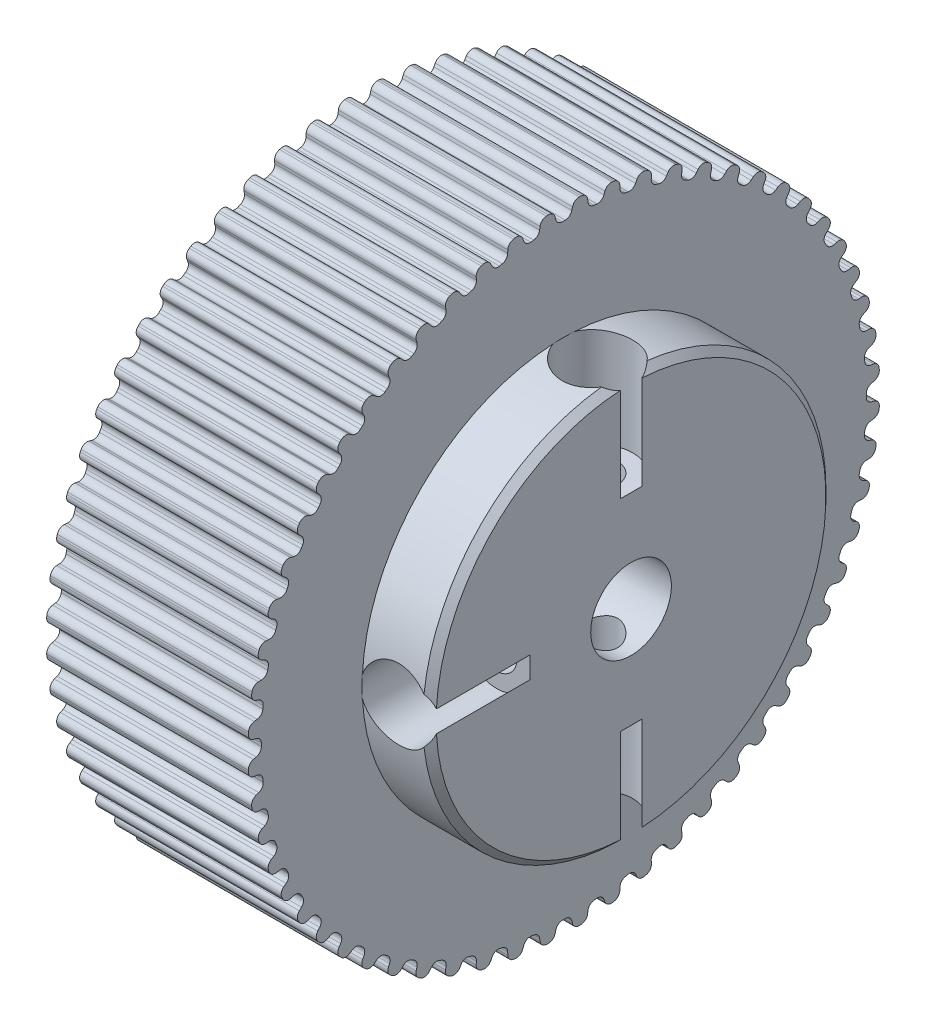
from build123d import *

# Parameters (mm, degrees)
CHAMFER1_SIZE      = 1
SKETCH2_R          = 6
CUT_EXTRUDE1_DEPTH = 78.575769413
SKETCH3_R          = 3
CUT_EXTRUDE3_DEPTH = 78.575769413
SKETCH4_R          = 5.25
CUT_EXTRUDE4_DEPTH = 15
CIRPATTERN1_COUNT  = 3
CIRPATTERN1_ANGLE  = 180
CUT_EXTRUDE5_DEPTH = 78.575769464
FILLET1_R          = 1
CIRPATTERN2_DEPTH  = 30


# Read off the part's stored shape, not the designer's step: CirPattern2
with BuildPart() as part:
    # Sketch1 → Revolve1 (revolve)
    with BuildSketch(Plane.XY, mode=Mode.PRIVATE) as revolve1_sk:
        Polygon((0, 0), (0, 47), (30, 47), (30, 30), (40, 30), (40, 0), align=None)
    revolve(revolve1_sk.sketch.rotate(Axis((-15.822381893, 0, 0), (1, 0, 0)), 90), axis=Axis((-15.822381893, 0, 0), (1, 0, 0)))

    # Chamfer1
    chamfer1_edges = [part.edges().sort_by_distance(p)[0] for p in [
        (40, 0, -30),
    ]]
    chamfer(chamfer1_edges, length=CHAMFER1_SIZE)

    # Sketch2 → Cut-Extrude1 (cut, through all)
    with BuildSketch(Plane.ZY):
        Circle(SKETCH2_R)
    extrude(amount=-CUT_EXTRUDE1_DEPTH, mode=Mode.SUBTRACT)

    # Sketch3 → Cut-Extrude3 (cut, through all)
    with BuildSketch(Plane(origin=(0, 0, 0), x_dir=(1, 0, 0), z_dir=(0, 1, 0))):
        with Locations(Location((35, 0, 0), (0, 0, 90))):
            Circle(SKETCH3_R)
    cut_extrude3 = extrude(amount=CUT_EXTRUDE3_DEPTH, mode=Mode.SUBTRACT)

    # Sketch4 → Cut-Extrude4 (cut)
    with BuildSketch(Plane(origin=(0, 30, 0), x_dir=(1, 0, 0), z_dir=(0, 1, 0))):
        with Locations((35, 0)):
            Circle(SKETCH4_R)
    cut_extrude4 = extrude(amount=-CUT_EXTRUDE4_DEPTH, mode=Mode.SUBTRACT)

    # CirPattern1: Cut-Extrude3, Cut-Extrude4 ×3 about axis
    cirpattern1_axis = Axis((0, 0, 0), (1, 0, 0))
    add([cut_extrude3.rotate(cirpattern1_axis, i * CIRPATTERN1_ANGLE / (CIRPATTERN1_COUNT - 1)) for i in range(1, CIRPATTERN1_COUNT)], mode=Mode.SUBTRACT)
    add([cut_extrude4.rotate(cirpattern1_axis, i * CIRPATTERN1_ANGLE / (CIRPATTERN1_COUNT - 1)) for i in range(1, CIRPATTERN1_COUNT)], mode=Mode.SUBTRACT)

    # Sketch6 → Cut-Extrude5 (cut, through all)
    with BuildSketch(Plane.ZY):
        Polygon((-2, 49), (2, 49), (1, 45), (-1, 45), align=None)
    extrude(amount=-CUT_EXTRUDE5_DEPTH, mode=Mode.SUBTRACT)

    # Fillet1
    fillet1_edges = [part.edges().sort_by_distance(p)[0] for p in [
        (15, 46.976246971, -1.494061743),
        (15, 45, -1),
        (15, 46.976246971, 1.494061743),
        (15, 45, 1),
    ]]
    fillet(fillet1_edges, radius=FILLET1_R)

    # CirPattern2 outline → CirPattern2 (cut)
    with BuildSketch(Plane.YZ):
        with BuildLine():
            ThreePointArc((44.776400397, 4.485758183), (45.051362819, 3.895855826), (45.631122807, 3.600106812))
            Line((45.631122807, 3.600106812), (46.069172282, 3.538260379))
            ThreePointArc((46.069172282, 3.538260379), (46.665829094, 3.224565669), (46.927837423, 2.6034736))
            ThreePointArc((46.927837423, 2.6034736), (46.742529082, 4.912837773), (46.443644181, 7.210264569))
            ThreePointArc((46.443644181, 7.210264569), (46.316493665, 6.548270257), (45.798096033, 6.117378603))
            Line((45.798096033, 6.117378603), (45.382477587, 5.965808056))
            ThreePointArc((45.382477587, 5.965808056), (44.876876423, 5.555982988), (44.730570186, 4.921803511))
            Line((44.730570186, 4.921803511), (44.776400397, 4.485758183))
        make_face()
        with BuildLine():
            ThreePointArc((45.798096033, -6.117378603), (46.316493665, -6.548270257), (46.443644181, -7.210264569))
            ThreePointArc((46.443644181, -7.210264569), (46.742529082, -4.912837773), (46.927837423, -2.6034736))
            ThreePointArc((46.927837423, -2.6034736), (46.665829094, -3.224565669), (46.069172282, -3.538260379))
            Line((46.069172282, -3.538260379), (45.631122807, -3.600106812))
            ThreePointArc((45.631122807, -3.600106812), (45.051362819, -3.895855826), (44.776400397, -4.485758183))
            Line((44.776400397, -4.485758183), (44.730570186, -4.921803511))
            ThreePointArc((44.730570186, -4.921803511), (44.876876423, -5.555982988), (45.382477587, -5.965808056))
            Line((45.382477587, -5.965808056), (45.798096033, -6.117378603))
        make_face()
        with BuildLine():
            ThreePointArc((44.907769087, -10.871071562), (45.378286439, -11.353790055), (45.435543164, -12.02544874))
            ThreePointArc((45.435543164, -12.02544874), (45.972937234, -9.771849468), (46.398624725, -7.49450623))
            ThreePointArc((46.398624725, -7.49450623), (46.073129905, -8.084808563), (45.446951616, -8.334417201))
            Line((45.446951616, -8.334417201), (45.00483711, -8.350136195))
            ThreePointArc((45.00483711, -8.350136195), (44.397338917, -8.583663644), (44.062221181, -9.141593055))
            Line((44.062221181, -9.141593055), (43.971062885, -9.570459119))
            ThreePointArc((43.971062885, -9.570459119), (44.050277835, -10.21645766), (44.510270878, -10.676887377))
            Line((44.510270878, -10.676887377), (44.907769087, -10.871071562))
        make_face()
        with BuildLine():
            ThreePointArc((43.525423224, -15.505658786), (43.942905211, -16.034915352), (43.929640827, -16.708879579))
            ThreePointArc((43.929640827, -16.708879579), (44.699656266, -14.523798736), (45.361058985, -12.303427481))
            ThreePointArc((45.361058985, -12.303427481), (44.975643864, -12.856472603), (44.326804637, -13.039260404))
            Line((44.326804637, -13.039260404), (43.885468998, -13.008679738))
            ThreePointArc((43.885468998, -13.008679738), (43.256888479, -13.177427047), (42.865287049, -13.69727072))
            Line((42.865287049, -13.69727072), (42.729799417, -14.114258774))
            ThreePointArc((42.729799417, -14.114258774), (42.741055184, -14.764998685), (43.150400327, -15.270988485))
            Line((43.150400327, -15.270988485), (43.525423224, -15.505658786))
        make_face()
        with BuildLine():
            ThreePointArc((41.666203717, -19.970362767), (42.026076318, -20.540358761), (41.942436153, -21.209244436))
            ThreePointArc((41.942436153, -21.209244436), (42.936636509, -19.116622225), (43.82650799, -16.977549806))
            ThreePointArc((43.82650799, -16.977549806), (43.385395256, -17.487278438), (42.721003911, -17.601242742))
            Line((42.721003911, -17.601242742), (42.285282505, -17.524697463))
            ThreePointArc((42.285282505, -17.524697463), (41.642506519, -17.626815801), (41.198711862, -18.10287822))
            Line((41.198711862, -18.10287822), (41.020379325, -18.503419657))
            ThreePointArc((41.020379325, -18.503419657), (40.963552589, -19.151771295), (41.317764961, -19.697777448))
            Line((41.317764961, -19.697777448), (41.666203717, -19.970362767))
        make_face()
        with BuildLine():
            ThreePointArc((39.350480563, -24.216267275), (39.648800939, -24.820757701), (39.495701372, -25.477236372))
            ThreePointArc((39.495701372, -25.477236372), (40.703193978, -23.5), (41.811784602, -21.465662542))
            ThreePointArc((41.811784602, -21.465662542), (41.31980718, -21.926489992), (40.647142927, -21.970382181))
            Line((40.647142927, -21.970382181), (40.221809608, -21.848710936))
            ThreePointArc((40.221809608, -21.848710936), (39.571880543, -21.883081473), (39.080754967, -22.310146799))
            Line((39.080754967, -22.310146799), (38.861531374, -22.689853201))
            ThreePointArc((38.861531374, -22.689853201), (38.73724474, -23.328713089), (39.032443515, -23.908753439))
            Line((39.032443515, -23.908753439), (39.350480563, -24.216267275))
        make_face()
        with BuildLine():
            ThreePointArc((36.603625308, -28.196853291), (36.837124999, -28.829215226), (36.616243421, -29.466094376))
            ThreePointArc((36.616243421, -29.466094376), (38.023798735, -27.625906858), (39.338962553, -25.718592988))
            ThreePointArc((39.338962553, -25.718592988), (38.801510649, -26.125470332), (38.127943338, -26.098809515))
            Line((38.127943338, -26.098809515), (37.717658148, -25.93334536))
            ThreePointArc((37.717658148, -25.93334536), (37.067696763, -25.899591524), (36.534621142, -26.27298074))
            Line((36.534621142, -26.27298074), (36.276908352, -26.627691966))
            ThreePointArc((36.276908352, -26.627691966), (36.086523531, -27.250060622), (36.319474449, -27.857780124))
            Line((36.319474449, -27.857780124), (36.603625308, -28.196853291))
        make_face()
        with BuildLine():
            ThreePointArc((33.455733075, -31.868508682), (33.621853809, -32.521813836), (33.335610244, -33.132115683))
            ThreePointArc((33.335610244, -33.132115683), (34.927806797, -31.449138499), (36.435134598, -29.689745146))
            ThreePointArc((36.435134598, -29.689745146), (35.858096648, -30.038214553), (35.191006023, -29.94129283))
            Line((35.191006023, -29.94129283), (34.800264133, -29.733848625))
            ThreePointArc((34.800264133, -29.733848625), (34.157391541, -29.632340232), (33.588206363, -29.947962407))
            Line((33.588206363, -29.947962407), (33.29482793, -30.273792165))
            ThreePointArc((33.29482793, -30.273792165), (33.040430818, -30.872850788), (33.208581622, -31.501591141))
            Line((33.208581622, -31.501591141), (33.455733075, -31.868508682))
        make_face()
        with BuildLine():
            ThreePointArc((29.94129283, -35.191006023), (30.038214553, -35.858096648), (29.689745146, -36.435134598))
            ThreePointArc((29.689745146, -36.435134598), (31.449138499, -34.927806797), (33.132115683, -33.335610244))
            ThreePointArc((33.132115683, -33.335610244), (32.521813836, -33.621853809), (31.868508682, -33.455733075))
            Line((31.868508682, -33.455733075), (31.501591141, -33.208581622))
            ThreePointArc((31.501591141, -33.208581622), (30.872850788, -33.040430818), (30.273792165, -33.29482793))
            Line((30.273792165, -33.29482793), (29.947962407, -33.588206363))
            ThreePointArc((29.947962407, -33.588206363), (29.632340232, -34.157391541), (29.733848625, -34.800264133))
            Line((29.733848625, -34.800264133), (29.94129283, -35.191006023))
        make_face()
        with BuildLine():
            ThreePointArc((26.098809515, -38.127943338), (26.125470332, -38.801510649), (25.718592988, -39.338962553))
            ThreePointArc((25.718592988, -39.338962553), (27.625906858, -38.023798735), (29.466094376, -36.616243421))
            ThreePointArc((29.466094376, -36.616243421), (28.829215226, -36.837124999), (28.196853291, -36.603625308))
            Line((28.196853291, -36.603625308), (27.857780124, -36.319474449))
            ThreePointArc((27.857780124, -36.319474449), (27.250060622, -36.086523531), (26.627691966, -36.276908352))
            Line((26.627691966, -36.276908352), (26.27298074, -36.534621142))
            ThreePointArc((26.27298074, -36.534621142), (25.899591524, -37.067696763), (25.93334536, -37.717658148))
            Line((25.93334536, -37.717658148), (26.098809515, -38.127943338))
        make_face()
        with BuildLine():
            ThreePointArc((21.970382181, -40.647142927), (21.926489992, -41.31980718), (21.465662542, -41.811784602))
            ThreePointArc((21.465662542, -41.811784602), (23.5, -40.703193978), (25.477236372, -39.495701372))
            ThreePointArc((25.477236372, -39.495701372), (24.820757701, -39.648800939), (24.216267275, -39.350480563))
            Line((24.216267275, -39.350480563), (23.908753439, -39.032443515))
            ThreePointArc((23.908753439, -39.032443515), (23.328713089, -38.73724474), (22.689853201, -38.861531374))
            Line((22.689853201, -38.861531374), (22.310146799, -39.080754967))
            ThreePointArc((22.310146799, -39.080754967), (21.883081473, -39.571880543), (21.848710936, -40.221809608))
            Line((21.848710936, -40.221809608), (21.970382181, -40.647142927))
        make_face()
        with BuildLine():
            ThreePointArc((17.601242742, -42.721003911), (17.487278438, -43.385395256), (16.977549806, -43.82650799))
            ThreePointArc((16.977549806, -43.82650799), (19.116622225, -42.936636509), (21.209244436, -41.942436153))
            ThreePointArc((21.209244436, -41.942436153), (20.540358761, -42.026076318), (19.970362767, -41.666203717))
            Line((19.970362767, -41.666203717), (19.697777448, -41.317764961))
            ThreePointArc((19.697777448, -41.317764961), (19.151771295, -40.963552589), (18.503419657, -41.020379325))
            Line((18.503419657, -41.020379325), (18.10287822, -41.198711862))
            ThreePointArc((18.10287822, -41.198711862), (17.626815801, -41.642506519), (17.524697463, -42.285282505))
            Line((17.524697463, -42.285282505), (17.601242742, -42.721003911))
        make_face()
        with BuildLine():
            ThreePointArc((13.039260404, -44.326804637), (12.856472603, -44.975643864), (12.303427481, -45.361058985))
            ThreePointArc((12.303427481, -45.361058985), (14.523798736, -44.699656266), (16.708879579, -43.929640827))
            ThreePointArc((16.708879579, -43.929640827), (16.034915352, -43.942905211), (15.505658786, -43.525423224))
            Line((15.505658786, -43.525423224), (15.270988485, -43.150400327))
            ThreePointArc((15.270988485, -43.150400327), (14.764998685, -42.741055184), (14.114258774, -42.729799417))
            Line((14.114258774, -42.729799417), (13.69727072, -42.865287049))
            ThreePointArc((13.69727072, -42.865287049), (13.177427047, -43.256888479), (13.008679738, -43.885468998))
            Line((13.008679738, -43.885468998), (13.039260404, -44.326804637))
        make_face()
        with BuildLine():
            ThreePointArc((8.334417201, -45.446951616), (8.084808563, -46.073129905), (7.49450623, -46.398624725))
            ThreePointArc((7.49450623, -46.398624725), (9.771849468, -45.972937234), (12.02544874, -45.435543164))
            ThreePointArc((12.02544874, -45.435543164), (11.353790055, -45.378286439), (10.871071562, -44.907769087))
            Line((10.871071562, -44.907769087), (10.676887377, -44.510270878))
            ThreePointArc((10.676887377, -44.510270878), (10.21645766, -44.050277835), (9.570459119, -43.971062885))
            Line((9.570459119, -43.971062885), (9.141593055, -44.062221181))
            ThreePointArc((9.141593055, -44.062221181), (8.583663644, -44.397338917), (8.350136195, -45.00483711))
            Line((8.350136195, -45.00483711), (8.334417201, -45.446951616))
        make_face()
        with BuildLine():
            ThreePointArc((3.538260379, -46.069172282), (3.224565669, -46.665829094), (2.6034736, -46.927837423))
            ThreePointArc((2.6034736, -46.927837423), (4.912837773, -46.742529082), (7.210264569, -46.443644181))
            ThreePointArc((7.210264569, -46.443644181), (6.548270257, -46.316493665), (6.117378603, -45.798096033))
            Line((6.117378603, -45.798096033), (5.965808056, -45.382477587))
            ThreePointArc((5.965808056, -45.382477587), (5.555982988, -44.876876423), (4.921803511, -44.730570186))
            Line((4.921803511, -44.730570186), (4.485758183, -44.776400397))
            ThreePointArc((4.485758183, -44.776400397), (3.895855826, -45.051362819), (3.600106812, -45.631122807))
            Line((3.600106812, -45.631122807), (3.538260379, -46.069172282))
        make_face()
        with BuildLine():
            ThreePointArc((-1.296662364, -46.186649456), (-1.671006242, -46.747247693), (-2.316083231, -46.942898914))
            ThreePointArc((-2.316083231, -46.942898914), (0, -47), (2.316083231, -46.942898914))
            ThreePointArc((2.316083231, -46.942898914), (1.671006242, -46.747247693), (1.296662364, -46.186649456))
            Line((1.296662364, -46.186649456), (1.189366094, -45.757464375))
            ThreePointArc((1.189366094, -45.757464375), (0.834635803, -45.211794562), (0.219223594, -45))
            Line((0.219223594, -45), (-0.219223594, -45))
            ThreePointArc((-0.219223594, -45), (-0.834635803, -45.211794562), (-1.189366094, -45.757464375))
            Line((-1.189366094, -45.757464375), (-1.296662364, -46.186649456))
        make_face()
        with BuildLine():
            ThreePointArc((-6.117378603, -45.798096033), (-6.548270257, -46.316493665), (-7.210264569, -46.443644181))
            ThreePointArc((-7.210264569, -46.443644181), (-4.912837773, -46.742529082), (-2.6034736, -46.927837423))
            ThreePointArc((-2.6034736, -46.927837423), (-3.224565669, -46.665829094), (-3.538260379, -46.069172282))
            Line((-3.538260379, -46.069172282), (-3.600106812, -45.631122807))
            ThreePointArc((-3.600106812, -45.631122807), (-3.895855826, -45.051362819), (-4.485758183, -44.776400397))
            Line((-4.485758183, -44.776400397), (-4.921803511, -44.730570186))
            ThreePointArc((-4.921803511, -44.730570186), (-5.555982988, -44.876876423), (-5.965808056, -45.382477587))
            Line((-5.965808056, -45.382477587), (-6.117378603, -45.798096033))
        make_face()
        with BuildLine():
            ThreePointArc((-10.871071562, -44.907769087), (-11.353790055, -45.378286439), (-12.02544874, -45.435543164))
            ThreePointArc((-12.02544874, -45.435543164), (-9.771849468, -45.972937234), (-7.49450623, -46.398624725))
            ThreePointArc((-7.49450623, -46.398624725), (-8.084808563, -46.073129905), (-8.334417201, -45.446951616))
            Line((-8.334417201, -45.446951616), (-8.350136195, -45.00483711))
            ThreePointArc((-8.350136195, -45.00483711), (-8.583663644, -44.397338917), (-9.141593055, -44.062221181))
            Line((-9.141593055, -44.062221181), (-9.570459119, -43.971062885))
            ThreePointArc((-9.570459119, -43.971062885), (-10.21645766, -44.050277835), (-10.676887377, -44.510270878))
            Line((-10.676887377, -44.510270878), (-10.871071562, -44.907769087))
        make_face()
        with BuildLine():
            ThreePointArc((-15.505658786, -43.525423224), (-16.034915352, -43.942905211), (-16.708879579, -43.929640827))
            ThreePointArc((-16.708879579, -43.929640827), (-14.523798736, -44.699656266), (-12.303427481, -45.361058985))
            ThreePointArc((-12.303427481, -45.361058985), (-12.856472603, -44.975643864), (-13.039260404, -44.326804637))
            Line((-13.039260404, -44.326804637), (-13.008679738, -43.885468998))
            ThreePointArc((-13.008679738, -43.885468998), (-13.177427047, -43.256888479), (-13.69727072, -42.865287049))
            Line((-13.69727072, -42.865287049), (-14.114258774, -42.729799417))
            ThreePointArc((-14.114258774, -42.729799417), (-14.764998685, -42.741055184), (-15.270988485, -43.150400327))
            Line((-15.270988485, -43.150400327), (-15.505658786, -43.525423224))
        make_face()
        with BuildLine():
            ThreePointArc((-19.970362767, -41.666203717), (-20.540358761, -42.026076318), (-21.209244436, -41.942436153))
            ThreePointArc((-21.209244436, -41.942436153), (-19.116622225, -42.936636509), (-16.977549806, -43.82650799))
            ThreePointArc((-16.977549806, -43.82650799), (-17.487278438, -43.385395256), (-17.601242742, -42.721003911))
            Line((-17.601242742, -42.721003911), (-17.524697463, -42.285282505))
            ThreePointArc((-17.524697463, -42.285282505), (-17.626815801, -41.642506519), (-18.10287822, -41.198711862))
            Line((-18.10287822, -41.198711862), (-18.503419657, -41.020379325))
            ThreePointArc((-18.503419657, -41.020379325), (-19.151771295, -40.963552589), (-19.697777448, -41.317764961))
            Line((-19.697777448, -41.317764961), (-19.970362767, -41.666203717))
        make_face()
        with BuildLine():
            ThreePointArc((-24.216267275, -39.350480563), (-24.820757701, -39.648800939), (-25.477236372, -39.495701372))
            ThreePointArc((-25.477236372, -39.495701372), (-23.5, -40.703193978), (-21.465662542, -41.811784602))
            ThreePointArc((-21.465662542, -41.811784602), (-21.926489992, -41.31980718), (-21.970382181, -40.647142927))
            Line((-21.970382181, -40.647142927), (-21.848710936, -40.221809608))
            ThreePointArc((-21.848710936, -40.221809608), (-21.883081473, -39.571880543), (-22.310146799, -39.080754967))
            Line((-22.310146799, -39.080754967), (-22.689853201, -38.861531374))
            ThreePointArc((-22.689853201, -38.861531374), (-23.328713089, -38.73724474), (-23.908753439, -39.032443515))
            Line((-23.908753439, -39.032443515), (-24.216267275, -39.350480563))
        make_face()
        with BuildLine():
            ThreePointArc((-28.196853291, -36.603625308), (-28.829215226, -36.837124999), (-29.466094376, -36.616243421))
            ThreePointArc((-29.466094376, -36.616243421), (-27.625906858, -38.023798735), (-25.718592988, -39.338962553))
            ThreePointArc((-25.718592988, -39.338962553), (-26.125470332, -38.801510649), (-26.098809515, -38.127943338))
            Line((-26.098809515, -38.127943338), (-25.93334536, -37.717658148))
            ThreePointArc((-25.93334536, -37.717658148), (-25.899591524, -37.067696763), (-26.27298074, -36.534621142))
            Line((-26.27298074, -36.534621142), (-26.627691966, -36.276908352))
            ThreePointArc((-26.627691966, -36.276908352), (-27.250060622, -36.086523531), (-27.857780124, -36.319474449))
            Line((-27.857780124, -36.319474449), (-28.196853291, -36.603625308))
        make_face()
        with BuildLine():
            ThreePointArc((-31.868508682, -33.455733075), (-32.521813836, -33.621853809), (-33.132115683, -33.335610244))
            ThreePointArc((-33.132115683, -33.335610244), (-31.449138499, -34.927806798), (-29.689745146, -36.435134598))
            ThreePointArc((-29.689745146, -36.435134598), (-30.038214553, -35.858096648), (-29.94129283, -35.191006023))
            Line((-29.94129283, -35.191006023), (-29.733848625, -34.800264133))
            ThreePointArc((-29.733848625, -34.800264133), (-29.632340232, -34.157391541), (-29.947962407, -33.588206363))
            Line((-29.947962407, -33.588206363), (-30.273792165, -33.29482793))
            ThreePointArc((-30.273792165, -33.29482793), (-30.872850788, -33.040430818), (-31.501591141, -33.208581622))
            Line((-31.501591141, -33.208581622), (-31.868508682, -33.455733075))
        make_face()
        with BuildLine():
            ThreePointArc((-35.191006023, -29.94129283), (-35.858096648, -30.038214553), (-36.435134598, -29.689745146))
            ThreePointArc((-36.435134598, -29.689745146), (-34.927806798, -31.449138499), (-33.335610244, -33.132115683))
            ThreePointArc((-33.335610244, -33.132115683), (-33.621853809, -32.521813836), (-33.455733075, -31.868508682))
            Line((-33.455733075, -31.868508682), (-33.208581622, -31.501591141))
            ThreePointArc((-33.208581622, -31.501591141), (-33.040430818, -30.872850788), (-33.29482793, -30.273792165))
            Line((-33.29482793, -30.273792165), (-33.588206363, -29.947962407))
            ThreePointArc((-33.588206363, -29.947962407), (-34.157391541, -29.632340232), (-34.800264133, -29.733848625))
            Line((-34.800264133, -29.733848625), (-35.191006023, -29.94129283))
        make_face()
        with BuildLine():
            ThreePointArc((-38.127943338, -26.098809515), (-38.801510649, -26.125470332), (-39.338962553, -25.718592988))
            ThreePointArc((-39.338962553, -25.718592988), (-38.023798735, -27.625906858), (-36.616243421, -29.466094376))
            ThreePointArc((-36.616243421, -29.466094376), (-36.837124999, -28.829215226), (-36.603625308, -28.196853291))
            Line((-36.603625308, -28.196853291), (-36.319474449, -27.857780124))
            ThreePointArc((-36.319474449, -27.857780124), (-36.086523531, -27.250060622), (-36.276908352, -26.627691966))
            Line((-36.276908352, -26.627691966), (-36.534621142, -26.27298074))
            ThreePointArc((-36.534621142, -26.27298074), (-37.067696763, -25.899591524), (-37.717658148, -25.93334536))
            Line((-37.717658148, -25.93334536), (-38.127943338, -26.098809515))
        make_face()
        with BuildLine():
            ThreePointArc((-40.647142927, -21.970382181), (-41.31980718, -21.926489992), (-41.811784602, -21.465662542))
            ThreePointArc((-41.811784602, -21.465662542), (-40.703193978, -23.5), (-39.495701372, -25.477236372))
            ThreePointArc((-39.495701372, -25.477236372), (-39.648800939, -24.820757701), (-39.350480563, -24.216267275))
            Line((-39.350480563, -24.216267275), (-39.032443515, -23.908753439))
            ThreePointArc((-39.032443515, -23.908753439), (-38.73724474, -23.328713089), (-38.861531374, -22.689853201))
            Line((-38.861531374, -22.689853201), (-39.080754967, -22.310146799))
            ThreePointArc((-39.080754967, -22.310146799), (-39.571880543, -21.883081473), (-40.221809608, -21.848710936))
            Line((-40.221809608, -21.848710936), (-40.647142927, -21.970382181))
        make_face()
        with BuildLine():
            ThreePointArc((-42.721003911, -17.601242742), (-43.385395256, -17.487278438), (-43.82650799, -16.977549806))
            ThreePointArc((-43.82650799, -16.977549806), (-42.936636509, -19.116622225), (-41.942436153, -21.209244436))
            ThreePointArc((-41.942436153, -21.209244436), (-42.026076318, -20.540358761), (-41.666203717, -19.970362767))
            Line((-41.666203717, -19.970362767), (-41.317764961, -19.697777448))
            ThreePointArc((-41.317764961, -19.697777448), (-40.963552589, -19.151771295), (-41.020379325, -18.503419657))
            Line((-41.020379325, -18.503419657), (-41.198711862, -18.10287822))
            ThreePointArc((-41.198711862, -18.10287822), (-41.642506519, -17.626815801), (-42.285282505, -17.524697463))
            Line((-42.285282505, -17.524697463), (-42.721003911, -17.601242742))
        make_face()
        with BuildLine():
            ThreePointArc((-44.326804637, -13.039260404), (-44.975643864, -12.856472603), (-45.361058985, -12.303427481))
            ThreePointArc((-45.361058985, -12.303427481), (-44.699656266, -14.523798736), (-43.929640827, -16.708879579))
            ThreePointArc((-43.929640827, -16.708879579), (-43.942905211, -16.034915352), (-43.525423224, -15.505658786))
            Line((-43.525423224, -15.505658786), (-43.150400327, -15.270988485))
            ThreePointArc((-43.150400327, -15.270988485), (-42.741055184, -14.764998685), (-42.729799417, -14.114258774))
            Line((-42.729799417, -14.114258774), (-42.865287049, -13.69727072))
            ThreePointArc((-42.865287049, -13.69727072), (-43.256888479, -13.177427047), (-43.885468998, -13.008679738))
            Line((-43.885468998, -13.008679738), (-44.326804637, -13.039260404))
        make_face()
        with BuildLine():
            ThreePointArc((-45.446951616, -8.334417201), (-46.073129905, -8.084808563), (-46.398624725, -7.49450623))
            ThreePointArc((-46.398624725, -7.49450623), (-45.972937235, -9.771849468), (-45.435543164, -12.02544874))
            ThreePointArc((-45.435543164, -12.02544874), (-45.378286439, -11.353790055), (-44.907769087, -10.871071562))
            Line((-44.907769087, -10.871071562), (-44.510270878, -10.676887377))
            ThreePointArc((-44.510270878, -10.676887377), (-44.050277835, -10.21645766), (-43.971062885, -9.570459119))
            Line((-43.971062885, -9.570459119), (-44.062221181, -9.141593055))
            ThreePointArc((-44.062221181, -9.141593055), (-44.397338917, -8.583663644), (-45.00483711, -8.350136195))
            Line((-45.00483711, -8.350136195), (-45.446951616, -8.334417201))
        make_face()
        with BuildLine():
            ThreePointArc((-46.069172282, -3.538260379), (-46.665829094, -3.224565669), (-46.927837423, -2.6034736))
            ThreePointArc((-46.927837423, -2.6034736), (-46.742529082, -4.912837773), (-46.443644181, -7.210264569))
            ThreePointArc((-46.443644181, -7.210264569), (-46.316493665, -6.548270257), (-45.798096033, -6.117378603))
            Line((-45.798096033, -6.117378603), (-45.382477587, -5.965808056))
            ThreePointArc((-45.382477587, -5.965808056), (-44.876876423, -5.555982988), (-44.730570186, -4.921803511))
            Line((-44.730570186, -4.921803511), (-44.776400397, -4.485758183))
            ThreePointArc((-44.776400397, -4.485758183), (-45.051362819, -3.895855826), (-45.631122807, -3.600106812))
            Line((-45.631122807, -3.600106812), (-46.069172282, -3.538260379))
        make_face()
        with BuildLine():
            ThreePointArc((-46.186649456, 1.296662364), (-46.747247693, 1.671006242), (-46.942898914, 2.316083231))
            ThreePointArc((-46.942898914, 2.316083231), (-47, 0), (-46.942898914, -2.316083231))
            ThreePointArc((-46.942898914, -2.316083231), (-46.747247693, -1.671006242), (-46.186649456, -1.296662364))
            Line((-46.186649456, -1.296662364), (-45.757464375, -1.189366094))
            ThreePointArc((-45.757464375, -1.189366094), (-45.211794562, -0.834635803), (-45, -0.219223594))
            Line((-45, -0.219223594), (-45, 0.219223594))
            ThreePointArc((-45, 0.219223594), (-45.211794562, 0.834635803), (-45.757464375, 1.189366094))
            Line((-45.757464375, 1.189366094), (-46.186649456, 1.296662364))
        make_face()
        with BuildLine():
            ThreePointArc((-45.798096033, 6.117378603), (-46.316493665, 6.548270257), (-46.443644181, 7.210264569))
            ThreePointArc((-46.443644181, 7.210264569), (-46.742529082, 4.912837773), (-46.927837423, 2.6034736))
            ThreePointArc((-46.927837423, 2.6034736), (-46.665829094, 3.224565669), (-46.069172282, 3.538260379))
            Line((-46.069172282, 3.538260379), (-45.631122807, 3.600106812))
            ThreePointArc((-45.631122807, 3.600106812), (-45.051362819, 3.895855826), (-44.776400397, 4.485758183))
            Line((-44.776400397, 4.485758183), (-44.730570186, 4.921803511))
            ThreePointArc((-44.730570186, 4.921803511), (-44.876876423, 5.555982988), (-45.382477587, 5.965808056))
            Line((-45.382477587, 5.965808056), (-45.798096033, 6.117378603))
        make_face()
        with BuildLine():
            ThreePointArc((-44.907769087, 10.871071562), (-45.378286439, 11.353790055), (-45.435543164, 12.02544874))
            ThreePointArc((-45.435543164, 12.02544874), (-45.972937235, 9.771849468), (-46.398624725, 7.49450623))
            ThreePointArc((-46.398624725, 7.49450623), (-46.073129905, 8.084808563), (-45.446951616, 8.334417201))
            Line((-45.446951616, 8.334417201), (-45.00483711, 8.350136195))
            ThreePointArc((-45.00483711, 8.350136195), (-44.397338917, 8.583663644), (-44.062221181, 9.141593055))
            Line((-44.062221181, 9.141593055), (-43.971062885, 9.570459119))
            ThreePointArc((-43.971062885, 9.570459119), (-44.050277835, 10.21645766), (-44.510270878, 10.676887377))
            Line((-44.510270878, 10.676887377), (-44.907769087, 10.871071562))
        make_face()
        with BuildLine():
            ThreePointArc((-43.525423224, 15.505658786), (-43.942905211, 16.034915352), (-43.929640827, 16.708879579))
            ThreePointArc((-43.929640827, 16.708879579), (-44.699656266, 14.523798736), (-45.361058985, 12.303427481))
            ThreePointArc((-45.361058985, 12.303427481), (-44.975643864, 12.856472603), (-44.326804637, 13.039260404))
            Line((-44.326804637, 13.039260404), (-43.885468998, 13.008679738))
            ThreePointArc((-43.885468998, 13.008679738), (-43.256888479, 13.177427047), (-42.865287049, 13.69727072))
            Line((-42.865287049, 13.69727072), (-42.729799417, 14.114258774))
            ThreePointArc((-42.729799417, 14.114258774), (-42.741055184, 14.764998685), (-43.150400327, 15.270988485))
            Line((-43.150400327, 15.270988485), (-43.525423224, 15.505658786))
        make_face()
        with BuildLine():
            ThreePointArc((-41.666203717, 19.970362767), (-42.026076318, 20.540358761), (-41.942436153, 21.209244436))
            ThreePointArc((-41.942436153, 21.209244436), (-42.936636509, 19.116622225), (-43.82650799, 16.977549806))
            ThreePointArc((-43.82650799, 16.977549806), (-43.385395256, 17.487278438), (-42.721003911, 17.601242742))
            Line((-42.721003911, 17.601242742), (-42.285282505, 17.524697463))
            ThreePointArc((-42.285282505, 17.524697463), (-41.642506519, 17.626815801), (-41.198711862, 18.10287822))
            Line((-41.198711862, 18.10287822), (-41.020379325, 18.503419657))
            ThreePointArc((-41.020379325, 18.503419657), (-40.963552589, 19.151771295), (-41.317764961, 19.697777448))
            Line((-41.317764961, 19.697777448), (-41.666203717, 19.970362767))
        make_face()
        with BuildLine():
            ThreePointArc((-39.350480563, 24.216267275), (-39.648800939, 24.820757701), (-39.495701372, 25.477236372))
            ThreePointArc((-39.495701372, 25.477236372), (-40.703193978, 23.5), (-41.811784602, 21.465662542))
            ThreePointArc((-41.811784602, 21.465662542), (-41.31980718, 21.926489992), (-40.647142927, 21.970382181))
            Line((-40.647142927, 21.970382181), (-40.221809608, 21.848710936))
            ThreePointArc((-40.221809608, 21.848710936), (-39.571880543, 21.883081473), (-39.080754967, 22.310146799))
            Line((-39.080754967, 22.310146799), (-38.861531374, 22.689853201))
            ThreePointArc((-38.861531374, 22.689853201), (-38.73724474, 23.328713089), (-39.032443515, 23.908753439))
            Line((-39.032443515, 23.908753439), (-39.350480563, 24.216267275))
        make_face()
        with BuildLine():
            ThreePointArc((-36.603625308, 28.196853291), (-36.837124999, 28.829215226), (-36.616243421, 29.466094376))
            ThreePointArc((-36.616243421, 29.466094376), (-38.023798735, 27.625906858), (-39.338962553, 25.718592988))
            ThreePointArc((-39.338962553, 25.718592988), (-38.801510649, 26.125470332), (-38.127943338, 26.098809515))
            Line((-38.127943338, 26.098809515), (-37.717658148, 25.93334536))
            ThreePointArc((-37.717658148, 25.93334536), (-37.067696763, 25.899591524), (-36.534621142, 26.27298074))
            Line((-36.534621142, 26.27298074), (-36.276908352, 26.627691966))
            ThreePointArc((-36.276908352, 26.627691966), (-36.086523531, 27.250060622), (-36.319474449, 27.857780124))
            Line((-36.319474449, 27.857780124), (-36.603625308, 28.196853291))
        make_face()
        with BuildLine():
            ThreePointArc((-33.455733075, 31.868508682), (-33.621853809, 32.521813836), (-33.335610244, 33.132115683))
            ThreePointArc((-33.335610244, 33.132115683), (-34.927806798, 31.449138499), (-36.435134598, 29.689745146))
            ThreePointArc((-36.435134598, 29.689745146), (-35.858096648, 30.038214553), (-35.191006023, 29.94129283))
            Line((-35.191006023, 29.94129283), (-34.800264133, 29.733848625))
            ThreePointArc((-34.800264133, 29.733848625), (-34.157391541, 29.632340232), (-33.588206363, 29.947962407))
            Line((-33.588206363, 29.947962407), (-33.29482793, 30.273792165))
            ThreePointArc((-33.29482793, 30.273792165), (-33.040430818, 30.872850788), (-33.208581622, 31.501591141))
            Line((-33.208581622, 31.501591141), (-33.455733075, 31.868508682))
        make_face()
        with BuildLine():
            ThreePointArc((-29.94129283, 35.191006023), (-30.038214553, 35.858096648), (-29.689745146, 36.435134598))
            ThreePointArc((-29.689745146, 36.435134598), (-31.449138499, 34.927806798), (-33.132115683, 33.335610244))
            ThreePointArc((-33.132115683, 33.335610244), (-32.521813836, 33.621853809), (-31.868508682, 33.455733075))
            Line((-31.868508682, 33.455733075), (-31.501591141, 33.208581622))
            ThreePointArc((-31.501591141, 33.208581622), (-30.872850788, 33.040430818), (-30.273792165, 33.29482793))
            Line((-30.273792165, 33.29482793), (-29.947962407, 33.588206363))
            ThreePointArc((-29.947962407, 33.588206363), (-29.632340232, 34.157391541), (-29.733848625, 34.800264133))
            Line((-29.733848625, 34.800264133), (-29.94129283, 35.191006023))
        make_face()
        with BuildLine():
            ThreePointArc((-26.098809515, 38.127943338), (-26.125470332, 38.801510649), (-25.718592988, 39.338962553))
            ThreePointArc((-25.718592988, 39.338962553), (-27.625906858, 38.023798735), (-29.466094376, 36.616243421))
            ThreePointArc((-29.466094376, 36.616243421), (-28.829215226, 36.837124999), (-28.196853291, 36.603625308))
            Line((-28.196853291, 36.603625308), (-27.857780124, 36.319474449))
            ThreePointArc((-27.857780124, 36.319474449), (-27.250060622, 36.086523531), (-26.627691966, 36.276908352))
            Line((-26.627691966, 36.276908352), (-26.27298074, 36.534621142))
            ThreePointArc((-26.27298074, 36.534621142), (-25.899591524, 37.067696763), (-25.93334536, 37.717658148))
            Line((-25.93334536, 37.717658148), (-26.098809515, 38.127943338))
        make_face()
        with BuildLine():
            ThreePointArc((-21.970382181, 40.647142927), (-21.926489992, 41.31980718), (-21.465662542, 41.811784602))
            ThreePointArc((-21.465662542, 41.811784602), (-23.5, 40.703193978), (-25.477236372, 39.495701372))
            ThreePointArc((-25.477236372, 39.495701372), (-24.820757701, 39.648800939), (-24.216267275, 39.350480563))
            Line((-24.216267275, 39.350480563), (-23.908753439, 39.032443515))
            ThreePointArc((-23.908753439, 39.032443515), (-23.328713089, 38.73724474), (-22.689853201, 38.861531374))
            Line((-22.689853201, 38.861531374), (-22.310146799, 39.080754967))
            ThreePointArc((-22.310146799, 39.080754967), (-21.883081473, 39.571880543), (-21.848710936, 40.221809608))
            Line((-21.848710936, 40.221809608), (-21.970382181, 40.647142927))
        make_face()
        with BuildLine():
            ThreePointArc((-17.601242742, 42.721003911), (-17.487278438, 43.385395256), (-16.977549806, 43.82650799))
            ThreePointArc((-16.977549806, 43.82650799), (-19.116622225, 42.936636509), (-21.209244436, 41.942436153))
            ThreePointArc((-21.209244436, 41.942436153), (-20.540358761, 42.026076318), (-19.970362767, 41.666203717))
            Line((-19.970362767, 41.666203717), (-19.697777448, 41.317764961))
            ThreePointArc((-19.697777448, 41.317764961), (-19.151771295, 40.963552589), (-18.503419657, 41.020379325))
            Line((-18.503419657, 41.020379325), (-18.10287822, 41.198711862))
            ThreePointArc((-18.10287822, 41.198711862), (-17.626815801, 41.642506519), (-17.524697463, 42.285282505))
            Line((-17.524697463, 42.285282505), (-17.601242742, 42.721003911))
        make_face()
        with BuildLine():
            ThreePointArc((-13.039260404, 44.326804637), (-12.856472603, 44.975643864), (-12.303427481, 45.361058985))
            ThreePointArc((-12.303427481, 45.361058985), (-14.523798736, 44.699656266), (-16.708879579, 43.929640827))
            ThreePointArc((-16.708879579, 43.929640827), (-16.034915352, 43.942905211), (-15.505658786, 43.525423224))
            Line((-15.505658786, 43.525423224), (-15.270988485, 43.150400327))
            ThreePointArc((-15.270988485, 43.150400327), (-14.764998685, 42.741055184), (-14.114258774, 42.729799417))
            Line((-14.114258774, 42.729799417), (-13.69727072, 42.865287049))
            ThreePointArc((-13.69727072, 42.865287049), (-13.177427047, 43.256888479), (-13.008679738, 43.885468998))
            Line((-13.008679738, 43.885468998), (-13.039260404, 44.326804637))
        make_face()
        with BuildLine():
            ThreePointArc((-8.334417201, 45.446951616), (-8.084808563, 46.073129905), (-7.49450623, 46.398624725))
            ThreePointArc((-7.49450623, 46.398624725), (-9.771849468, 45.972937234), (-12.02544874, 45.435543164))
            ThreePointArc((-12.02544874, 45.435543164), (-11.353790055, 45.378286439), (-10.871071562, 44.907769087))
            Line((-10.871071562, 44.907769087), (-10.676887377, 44.510270878))
            ThreePointArc((-10.676887377, 44.510270878), (-10.21645766, 44.050277835), (-9.570459119, 43.971062885))
            Line((-9.570459119, 43.971062885), (-9.141593055, 44.062221181))
            ThreePointArc((-9.141593055, 44.062221181), (-8.583663644, 44.397338917), (-8.350136195, 45.00483711))
            Line((-8.350136195, 45.00483711), (-8.334417201, 45.446951616))
        make_face()
        with BuildLine():
            ThreePointArc((-3.538260379, 46.069172282), (-3.224565669, 46.665829094), (-2.6034736, 46.927837423))
            ThreePointArc((-2.6034736, 46.927837423), (-4.912837773, 46.742529082), (-7.210264569, 46.443644181))
            ThreePointArc((-7.210264569, 46.443644181), (-6.548270257, 46.316493665), (-6.117378603, 45.798096033))
            Line((-6.117378603, 45.798096033), (-5.965808056, 45.382477587))
            ThreePointArc((-5.965808056, 45.382477587), (-5.555982988, 44.876876423), (-4.921803511, 44.730570186))
            Line((-4.921803511, 44.730570186), (-4.485758183, 44.776400397))
            ThreePointArc((-4.485758183, 44.776400397), (-3.895855826, 45.051362819), (-3.600106812, 45.631122807))
            Line((-3.600106812, 45.631122807), (-3.538260379, 46.069172282))
        make_face()
        with BuildLine():
            ThreePointArc((1.296662364, 46.186649456), (1.671006242, 46.747247693), (2.316083231, 46.942898914))
            ThreePointArc((2.316083231, 46.942898914), (0, 47), (-2.316083231, 46.942898914))
            ThreePointArc((-2.316083231, 46.942898914), (-1.671006242, 46.747247693), (-1.296662364, 46.186649456))
            Line((-1.296662364, 46.186649456), (-1.189366094, 45.757464375))
            ThreePointArc((-1.189366094, 45.757464375), (-0.834635803, 45.211794562), (-0.219223594, 45))
            Line((-0.219223594, 45), (0.219223594, 45))
            ThreePointArc((0.219223594, 45), (0.834635803, 45.211794562), (1.189366094, 45.757464375))
            Line((1.189366094, 45.757464375), (1.296662364, 46.186649456))
        make_face()
        with BuildLine():
            ThreePointArc((6.117378603, 45.798096033), (6.548270257, 46.316493665), (7.210264569, 46.443644181))
            ThreePointArc((7.210264569, 46.443644181), (4.912837773, 46.742529082), (2.6034736, 46.927837423))
            ThreePointArc((2.6034736, 46.927837423), (3.224565669, 46.665829094), (3.538260379, 46.069172282))
            Line((3.538260379, 46.069172282), (3.600106812, 45.631122807))
            ThreePointArc((3.600106812, 45.631122807), (3.895855826, 45.051362819), (4.485758183, 44.776400397))
            Line((4.485758183, 44.776400397), (4.921803511, 44.730570186))
            ThreePointArc((4.921803511, 44.730570186), (5.555982988, 44.876876423), (5.965808056, 45.382477587))
            Line((5.965808056, 45.382477587), (6.117378603, 45.798096033))
        make_face()
        with BuildLine():
            ThreePointArc((10.871071562, 44.907769087), (11.353790055, 45.378286439), (12.02544874, 45.435543164))
            ThreePointArc((12.02544874, 45.435543164), (9.771849468, 45.972937234), (7.49450623, 46.398624725))
            ThreePointArc((7.49450623, 46.398624725), (8.084808563, 46.073129905), (8.334417201, 45.446951616))
            Line((8.334417201, 45.446951616), (8.350136195, 45.00483711))
            ThreePointArc((8.350136195, 45.00483711), (8.583663644, 44.397338917), (9.141593055, 44.062221181))
            Line((9.141593055, 44.062221181), (9.570459119, 43.971062885))
            ThreePointArc((9.570459119, 43.971062885), (10.21645766, 44.050277835), (10.676887377, 44.510270878))
            Line((10.676887377, 44.510270878), (10.871071562, 44.907769087))
        make_face()
        with BuildLine():
            ThreePointArc((15.505658786, 43.525423224), (16.034915352, 43.942905211), (16.708879579, 43.929640827))
            ThreePointArc((16.708879579, 43.929640827), (14.523798736, 44.699656266), (12.303427481, 45.361058985))
            ThreePointArc((12.303427481, 45.361058985), (12.856472603, 44.975643864), (13.039260404, 44.326804637))
            Line((13.039260404, 44.326804637), (13.008679738, 43.885468998))
            ThreePointArc((13.008679738, 43.885468998), (13.177427047, 43.256888479), (13.69727072, 42.865287049))
            Line((13.69727072, 42.865287049), (14.114258774, 42.729799417))
            ThreePointArc((14.114258774, 42.729799417), (14.764998685, 42.741055184), (15.270988485, 43.150400327))
            Line((15.270988485, 43.150400327), (15.505658786, 43.525423224))
        make_face()
        with BuildLine():
            ThreePointArc((19.970362767, 41.666203717), (20.540358761, 42.026076318), (21.209244436, 41.942436153))
            ThreePointArc((21.209244436, 41.942436153), (19.116622225, 42.936636509), (16.977549806, 43.82650799))
            ThreePointArc((16.977549806, 43.82650799), (17.487278438, 43.385395256), (17.601242742, 42.721003911))
            Line((17.601242742, 42.721003911), (17.524697463, 42.285282505))
            ThreePointArc((17.524697463, 42.285282505), (17.626815801, 41.642506519), (18.10287822, 41.198711862))
            Line((18.10287822, 41.198711862), (18.503419657, 41.020379325))
            ThreePointArc((18.503419657, 41.020379325), (19.151771295, 40.963552589), (19.697777448, 41.317764961))
            Line((19.697777448, 41.317764961), (19.970362767, 41.666203717))
        make_face()
        with BuildLine():
            ThreePointArc((24.216267275, 39.350480563), (24.820757701, 39.648800939), (25.477236372, 39.495701372))
            ThreePointArc((25.477236372, 39.495701372), (23.5, 40.703193978), (21.465662542, 41.811784602))
            ThreePointArc((21.465662542, 41.811784602), (21.926489992, 41.31980718), (21.970382181, 40.647142927))
            Line((21.970382181, 40.647142927), (21.848710936, 40.221809608))
            ThreePointArc((21.848710936, 40.221809608), (21.883081473, 39.571880543), (22.310146799, 39.080754967))
            Line((22.310146799, 39.080754967), (22.689853201, 38.861531374))
            ThreePointArc((22.689853201, 38.861531374), (23.328713089, 38.73724474), (23.908753439, 39.032443515))
            Line((23.908753439, 39.032443515), (24.216267275, 39.350480563))
        make_face()
        with BuildLine():
            ThreePointArc((28.196853291, 36.603625308), (28.829215226, 36.837124999), (29.466094376, 36.616243421))
            ThreePointArc((29.466094376, 36.616243421), (27.625906858, 38.023798735), (25.718592988, 39.338962553))
            ThreePointArc((25.718592988, 39.338962553), (26.125470332, 38.801510649), (26.098809515, 38.127943338))
            Line((26.098809515, 38.127943338), (25.93334536, 37.717658148))
            ThreePointArc((25.93334536, 37.717658148), (25.899591524, 37.067696763), (26.27298074, 36.534621142))
            Line((26.27298074, 36.534621142), (26.627691966, 36.276908352))
            ThreePointArc((26.627691966, 36.276908352), (27.250060622, 36.086523531), (27.857780124, 36.319474449))
            Line((27.857780124, 36.319474449), (28.196853291, 36.603625308))
        make_face()
        with BuildLine():
            ThreePointArc((31.868508682, 33.455733075), (32.521813836, 33.621853809), (33.132115683, 33.335610244))
            ThreePointArc((33.132115683, 33.335610244), (31.449138499, 34.927806797), (29.689745146, 36.435134598))
            ThreePointArc((29.689745146, 36.435134598), (30.038214553, 35.858096648), (29.94129283, 35.191006023))
            Line((29.94129283, 35.191006023), (29.733848625, 34.800264133))
            ThreePointArc((29.733848625, 34.800264133), (29.632340232, 34.157391541), (29.947962407, 33.588206363))
            Line((29.947962407, 33.588206363), (30.273792165, 33.29482793))
            ThreePointArc((30.273792165, 33.29482793), (30.872850788, 33.040430818), (31.501591141, 33.208581622))
            Line((31.501591141, 33.208581622), (31.868508682, 33.455733075))
        make_face()
        with BuildLine():
            ThreePointArc((35.191006023, 29.94129283), (35.858096648, 30.038214553), (36.435134598, 29.689745146))
            ThreePointArc((36.435134598, 29.689745146), (34.927806797, 31.449138499), (33.335610244, 33.132115683))
            ThreePointArc((33.335610244, 33.132115683), (33.621853809, 32.521813836), (33.455733075, 31.868508682))
            Line((33.455733075, 31.868508682), (33.208581622, 31.501591141))
            ThreePointArc((33.208581622, 31.501591141), (33.040430818, 30.872850788), (33.29482793, 30.273792165))
            Line((33.29482793, 30.273792165), (33.588206363, 29.947962407))
            ThreePointArc((33.588206363, 29.947962407), (34.157391541, 29.632340232), (34.800264133, 29.733848625))
            Line((34.800264133, 29.733848625), (35.191006023, 29.94129283))
        make_face()
        with BuildLine():
            ThreePointArc((38.127943338, 26.098809515), (38.801510649, 26.125470332), (39.338962553, 25.718592988))
            ThreePointArc((39.338962553, 25.718592988), (38.023798735, 27.625906858), (36.616243421, 29.466094376))
            ThreePointArc((36.616243421, 29.466094376), (36.837124999, 28.829215226), (36.603625308, 28.196853291))
            Line((36.603625308, 28.196853291), (36.319474449, 27.857780124))
            ThreePointArc((36.319474449, 27.857780124), (36.086523531, 27.250060622), (36.276908352, 26.627691966))
            Line((36.276908352, 26.627691966), (36.534621142, 26.27298074))
            ThreePointArc((36.534621142, 26.27298074), (37.067696763, 25.899591524), (37.717658148, 25.93334536))
            Line((37.717658148, 25.93334536), (38.127943338, 26.098809515))
        make_face()
        with BuildLine():
            ThreePointArc((40.647142927, 21.970382181), (41.31980718, 21.926489992), (41.811784602, 21.465662542))
            ThreePointArc((41.811784602, 21.465662542), (40.703193978, 23.5), (39.495701372, 25.477236372))
            ThreePointArc((39.495701372, 25.477236372), (39.648800939, 24.820757701), (39.350480563, 24.216267275))
            Line((39.350480563, 24.216267275), (39.032443515, 23.908753439))
            ThreePointArc((39.032443515, 23.908753439), (38.73724474, 23.328713089), (38.861531374, 22.689853201))
            Line((38.861531374, 22.689853201), (39.080754967, 22.310146799))
            ThreePointArc((39.080754967, 22.310146799), (39.571880543, 21.883081473), (40.221809608, 21.848710936))
            Line((40.221809608, 21.848710936), (40.647142927, 21.970382181))
        make_face()
        with BuildLine():
            ThreePointArc((42.721003911, 17.601242742), (43.385395256, 17.487278438), (43.82650799, 16.977549806))
            ThreePointArc((43.82650799, 16.977549806), (42.936636509, 19.116622225), (41.942436153, 21.209244436))
            ThreePointArc((41.942436153, 21.209244436), (42.026076318, 20.540358761), (41.666203717, 19.970362767))
            Line((41.666203717, 19.970362767), (41.317764961, 19.697777448))
            ThreePointArc((41.317764961, 19.697777448), (40.963552589, 19.151771295), (41.020379325, 18.503419657))
            Line((41.020379325, 18.503419657), (41.198711862, 18.10287822))
            ThreePointArc((41.198711862, 18.10287822), (41.642506519, 17.626815801), (42.285282505, 17.524697463))
            Line((42.285282505, 17.524697463), (42.721003911, 17.601242742))
        make_face()
        with BuildLine():
            ThreePointArc((44.326804637, 13.039260404), (44.975643864, 12.856472603), (45.361058985, 12.303427481))
            ThreePointArc((45.361058985, 12.303427481), (44.699656266, 14.523798736), (43.929640827, 16.708879579))
            ThreePointArc((43.929640827, 16.708879579), (43.942905211, 16.034915352), (43.525423224, 15.505658786))
            Line((43.525423224, 15.505658786), (43.150400327, 15.270988485))
            ThreePointArc((43.150400327, 15.270988485), (42.741055184, 14.764998685), (42.729799417, 14.114258774))
            Line((42.729799417, 14.114258774), (42.865287049, 13.69727072))
            ThreePointArc((42.865287049, 13.69727072), (43.256888479, 13.177427047), (43.885468998, 13.008679738))
            Line((43.885468998, 13.008679738), (44.326804637, 13.039260404))
        make_face()
        with BuildLine():
            ThreePointArc((45.446951616, 8.334417201), (46.073129905, 8.084808563), (46.398624725, 7.49450623))
            ThreePointArc((46.398624725, 7.49450623), (45.972937234, 9.771849468), (45.435543164, 12.02544874))
            ThreePointArc((45.435543164, 12.02544874), (45.378286439, 11.353790055), (44.907769087, 10.871071562))
            Line((44.907769087, 10.871071562), (44.510270878, 10.676887377))
            ThreePointArc((44.510270878, 10.676887377), (44.050277835, 10.21645766), (43.971062885, 9.570459119))
            Line((43.971062885, 9.570459119), (44.062221181, 9.141593055))
            ThreePointArc((44.062221181, 9.141593055), (44.397338917, 8.583663644), (45.00483711, 8.350136195))
            Line((45.00483711, 8.350136195), (45.446951616, 8.334417201))
        make_face()
    extrude(amount=CIRPATTERN2_DEPTH, mode=Mode.SUBTRACT)


solid = part.part
